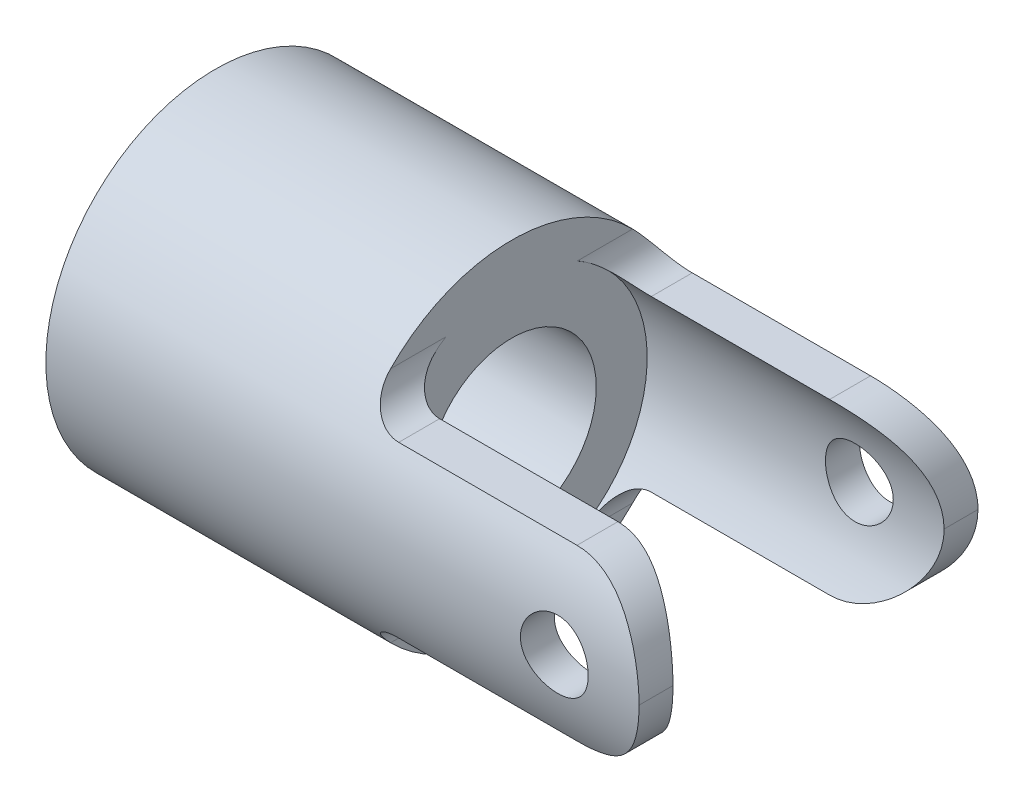
from build123d import *
from build123d.topology import SkipClean

# Parameters (mm, degrees)
SKETCH1_R                   = 6.35
FLANGE_BOTTOM_DEPTH         = 7.9248
SKETCH2_R                   = 6.35
FLANGMIDBODY_DEPTH          = 3.175
FLANGELEGS_DEPTH            = 11.1252
FILLET1_R                   = 3.175
LOCKINGSHAFTHOLE_DEPTH      = 22.060567449
LOCKINGSHAFTHOLE_DEPTH_BACK = 22.060567449
SKETCH4_R                   = 1.27
FILLET3_R                   = 1.27
SKETCH5_R                   = 3.17246
CENTERSHAFTHOLE_DEPTH       = 24.97072446
SKETCH11_R                  = 0.873550069
SET_SCREW_DEPTH             = 22.060567459
SKETCH12_R                  = 0.873550069
SUB_DRILL_DEPTH             = 1.27


# Some blends are built 0.0001 mm under size
with BuildPart() as part:
    # Sketch1 → Flange Bottom (new body)
    with BuildSketch(Plane(origin=(-19.05, 0, 0), x_dir=(0, 0, -1), z_dir=(1, 0, 0))):
        Circle(SKETCH1_R)
    extrude(amount=FLANGE_BOTTOM_DEPTH)

    # Sketch2 → Flangmidbody (add)
    with BuildSketch(Plane(origin=(-11.1252, 0, 0), x_dir=(0, 0, -1), z_dir=(1, 0, 0))):
        Circle(SKETCH2_R)
    extrude(amount=FLANGMIDBODY_DEPTH)

    # Sketch3 → Flangelegs (add)
    with SkipClean():  # the faces are left unmerged after this step: merging them gives an invalid solid
        with BuildSketch(Plane(origin=(-7.9502, 0, 0), x_dir=(0, 0, -1), z_dir=(1, 0, 0))):
            with BuildLine():
                Line((-5.499261314, 3.175), (-3.965573729, 3.175))
                ThreePointArc((-3.965573729, 3.175), (-5.08, 0), (-3.965573729, -3.175))
                Line((-3.965573729, -3.175), (-5.499261314, -3.175))
                ThreePointArc((-5.499261314, -3.175), (-6.35, 0), (-5.499261314, 3.175))
            make_face()
            with BuildLine():
                Line((3.965573729, 3.175), (5.499261314, 3.175))
                ThreePointArc((5.499261314, 3.175), (6.35, 0), (5.499261314, -3.175))
                Line((5.499261314, -3.175), (3.965573729, -3.175))
                ThreePointArc((3.965573729, -3.175), (5.08, 0), (3.965573729, 3.175))
            make_face()
        extrude(amount=FLANGELEGS_DEPTH)

    # Fillet1
    fillet1_edges = [part.edges().sort_by_distance(p)[0] for p in [
        (3.175, -3.175, -4.732417522),
        (3.175, 3.175, -4.732417522),
        (3.175, -3.175, 4.732417522),
        (3.175, 3.175, 4.732417522),
    ]]
    fillet(fillet1_edges, radius=FILLET1_R - 0.0001)  # a hair under: the kernel refuses the full size

    # Sketch4 → Lockingshafthole (cut, two sides: drawn at the far end of the back side and taken through both)
    with BuildSketch(Plane.XY.offset(-LOCKINGSHAFTHOLE_DEPTH_BACK)):
        Circle(SKETCH4_R)
    extrude(amount=LOCKINGSHAFTHOLE_DEPTH + LOCKINGSHAFTHOLE_DEPTH_BACK, mode=Mode.SUBTRACT)

    # Fillet3
    # the kernel refuses this fillet: 1.27 mm, written as the material it adds along each edge
    with BuildSketch(Plane(origin=(-7.9502, 3.175, -0.790573729), x_dir=(1, 0, 0), z_dir=(0, 0, -1))) as fillet3_piece_1_section:
        with BuildLine():
            CenterArc((FILLET3_R, -FILLET3_R), FILLET3_R, 90, 90)
            Line((0, -FILLET3_R), (0, 0))
            Line((0, 0), (FILLET3_R, 0))
        make_face()
    fillet3_piece_1 = extrude(amount=7.883687585, mode=Mode.PRIVATE)
    fillet3_piece_1 = fillet3_piece_1 & Plane(origin=(-7.671308244, 0, 0), x_dir=(0, 0.4999999999999997, -0.8660254037844388), z_dir=(-1, 0, 0)) * Cylinder(6.35, 21, mode=Mode.PRIVATE)
    fillet3_piece_1 = fillet3_piece_1 - Plane(origin=(-7.671308244, 0, 0), x_dir=(0, -0.6249999999999998, -0.7806247497997999), z_dir=(-1, 0, 0)) * Cylinder(5.08, 21, mode=Mode.PRIVATE)
    add(fillet3_piece_1)
    with BuildSketch(Plane(origin=(-7.9502, -3.175, -8.674261314), x_dir=(1, 0, 0), z_dir=(0, 0, 1))) as fillet3_piece_2_section:
        with BuildLine():
            CenterArc((FILLET3_R, -FILLET3_R), FILLET3_R, 90, 90)
            Line((0, -FILLET3_R), (0, 0))
            Line((0, 0), (FILLET3_R, 0))
        make_face()
    fillet3_piece_2 = extrude(amount=7.883687585, mode=Mode.PRIVATE)
    fillet3_piece_2 = fillet3_piece_2 & Plane(origin=(-7.671308757, 0, 0), x_dir=(0, 0.4999999999999997, -0.8660254037844388), z_dir=(-1, 0, 0)) * Cylinder(6.35, 21, mode=Mode.PRIVATE)
    fillet3_piece_2 = fillet3_piece_2 - Plane(origin=(-7.671308757, 0, 0), x_dir=(0, -0.6249999999999998, -0.7806247497997999), z_dir=(-1, 0, 0)) * Cylinder(5.08, 21, mode=Mode.PRIVATE)
    add(fillet3_piece_2)
    with BuildSketch(Plane(origin=(-7.9502, -3.175, 0.790573729), x_dir=(0, -1, 0), z_dir=(0, 0, 1))) as fillet3_piece_3_section:
        with BuildLine():
            CenterArc((FILLET3_R, FILLET3_R), FILLET3_R, 180, 90)
            Line((0, FILLET3_R), (0, 0))
            Line((0, 0), (FILLET3_R, 0))
        make_face()
    fillet3_piece_3 = extrude(amount=7.883687585, mode=Mode.PRIVATE)
    fillet3_piece_3 = fillet3_piece_3 & Plane(origin=(-7.671308363, 0, 0), x_dir=(0, 0, -1), z_dir=(-1, 0, 0)) * Cylinder(6.35, 21, mode=Mode.PRIVATE)
    fillet3_piece_3 = fillet3_piece_3 - Plane(origin=(-7.671308363, 0, 0), x_dir=(0, 0.6250000000000004, 0.7806247497997995), z_dir=(-1, 0, 0)) * Cylinder(5.08, 21, mode=Mode.PRIVATE)
    add(fillet3_piece_3)
    with BuildSketch(Plane(origin=(-7.9502, 3.175, 8.674261314), x_dir=(0, 1, 0), z_dir=(0, 0, -1))) as fillet3_piece_4_section:
        with BuildLine():
            CenterArc((FILLET3_R, FILLET3_R), FILLET3_R, 180, 90)
            Line((0, FILLET3_R), (0, 0))
            Line((0, 0), (FILLET3_R, 0))
        make_face()
    fillet3_piece_4 = extrude(amount=7.883687585, mode=Mode.PRIVATE)
    fillet3_piece_4 = fillet3_piece_4 & Plane(origin=(-7.671308731, 0, 0), x_dir=(0, 0, -1), z_dir=(-1, 0, 0)) * Cylinder(6.35, 21, mode=Mode.PRIVATE)
    fillet3_piece_4 = fillet3_piece_4 - Plane(origin=(-7.671308731, 0, 0), x_dir=(0, 0.6250000000000004, 0.7806247497997995), z_dir=(-1, 0, 0)) * Cylinder(5.08, 21, mode=Mode.PRIVATE)
    add(fillet3_piece_4)

    # Sketch5 → CenterShaftHole (cut, through all)
    with BuildSketch(Plane.ZY.offset(19.05)):
        Circle(SKETCH5_R)
    extrude(amount=-CENTERSHAFTHOLE_DEPTH, mode=Mode.SUBTRACT)

    # Sketch11 → Set Screw (cut, through all)
    with BuildSketch(Plane(origin=(0, 0, 0), x_dir=(1, 0, 0), z_dir=(0, 1, 0))):
        with Locations(Location((-15.0876, 0, 0), (0, 0, 270))):
            Circle(SKETCH11_R)
    extrude(amount=-SET_SCREW_DEPTH, mode=Mode.SUBTRACT)

    # Sketch12 → Sub Drill (cut)
    with BuildSketch(Plane.XY.offset(-6.35)):
        with Locations((-15.0876, 0)):
            Circle(SKETCH12_R)
    extrude(amount=SUB_DRILL_DEPTH, mode=Mode.SUBTRACT)


solid = part.part
